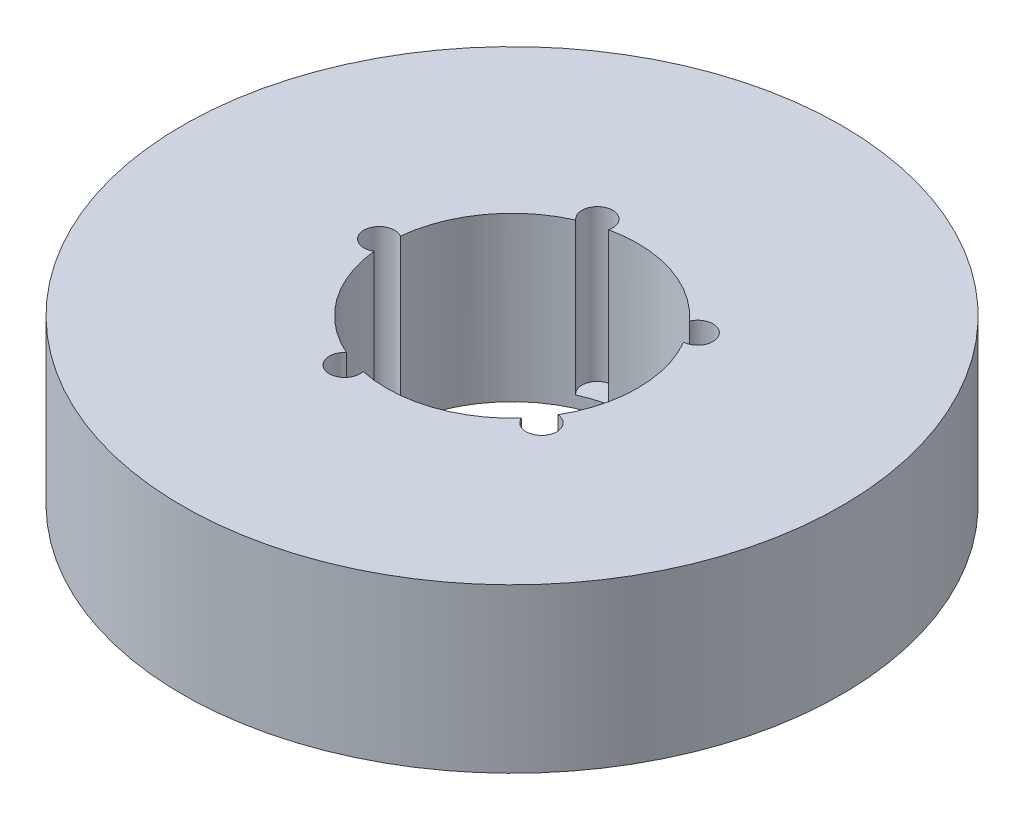
from build123d import *

# Parameters (mm, degrees)
SKETCH1_R           = 52.5
BOSS_EXTRUDE1_DEPTH = 26
SKETCH2_R           = 20
CUT_EXTRUDE1_DEPTH  = 79.667019773
SKETCH3_R           = 2.444049886
CUT_EXTRUDE2_DEPTH  = 24.127163513
CIRPATTERN1_COUNT   = 5


with BuildPart() as part:
    # Sketch1 → Boss-Extrude1 (new body)
    with BuildSketch(Plane(origin=(0, 0, 0), x_dir=(1, 0, 0), z_dir=(0, 1, 0))):
        Circle(SKETCH1_R)
    extrude(amount=BOSS_EXTRUDE1_DEPTH)

    # Sketch2 → Cut-Extrude1 (cut, through all)
    with BuildSketch(Plane(origin=(0, 0, 0), x_dir=(1, 0, 0), z_dir=(0, 1, 0))):
        Circle(SKETCH2_R)
    extrude(amount=CUT_EXTRUDE1_DEPTH, mode=Mode.SUBTRACT)

    # Sketch3 → Cut-Extrude2 (cut)
    with BuildSketch(Plane(origin=(0, 26, 0), x_dir=(1, 0, 0), z_dir=(0, 1, 0))):
        with Locations((-21.164206054, 0)):
            Circle(SKETCH3_R)
    cut_extrude2 = extrude(amount=-CUT_EXTRUDE2_DEPTH, mode=Mode.SUBTRACT)

    # CirPattern1: Cut-Extrude2 ×5 about axis
    cirpattern1_axis = Axis((0, 0, 0), (0, 1, 0))
    for i in range(1, CIRPATTERN1_COUNT):
        add(cut_extrude2.rotate(cirpattern1_axis, i * 360 / CIRPATTERN1_COUNT), mode=Mode.SUBTRACT)


solid = part.part
